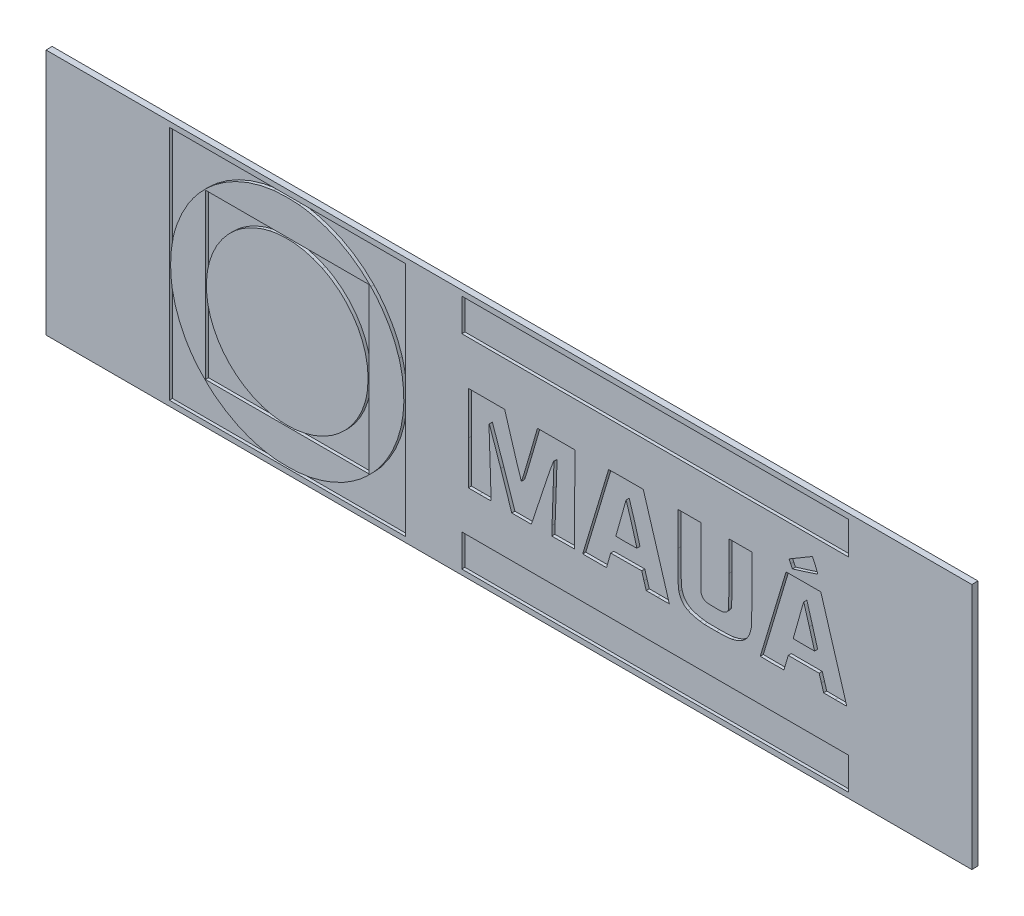
from build123d import *

# Parameters (mm, degrees)
SKETCH2_W                = 150
SKETCH2_H                = 40
BOSS_EXTRUDE1_DEPTH      = 1
CUT_EXTRUDE1_START       = -0.5
CUT_EXTRUDE1_OUTLINE_W   = 62.635342
CUT_EXTRUDE1_OUTLINE_H   = 5.214436
CUT_EXTRUDE1_OUTLINE_H_2 = 5.276518
CUT_EXTRUDE1_OUTLINE_W_2 = 38.23922
CUT_EXTRUDE1_OUTLINE_H_3 = 38.301299
CUT_EXTRUDE1_OUTLINE_W_3 = 26.506723
CUT_EXTRUDE1_OUTLINE_H_4 = 26.568808
CUT_EXTRUDE1_DEPTH       = 0.5


# Read off the part's stored shape, not the designer's step: Cut-Extrude1
with BuildPart() as part:
    # Sketch2 → Boss-Extrude1 (new body)
    with BuildSketch(Plane.XY):
        Rectangle(SKETCH2_W, SKETCH2_H)
    extrude(amount=-BOSS_EXTRUDE1_DEPTH)

    # Cut-Extrude1 outline → Cut-Extrude1 (cut)
    # profile 1 of 9: a face of its own
    with BuildSketch(Plane.XY.offset(CUT_EXTRUDE1_START)):
        with BuildLine():
            add(Edge.make_bspline(
                [(45.942737, 7.666566), (45.918534, 7.666566), (45.78378, 7.918242), (45.643276, 8.225843)],
                knots=[0, 0, 0, 0, 1, 1, 1, 1], degree=3))
            add(Edge.make_bspline(
                [(50.047431, 8.963367), (50.002706, 8.923569), (46.024116, 7.666566), (45.942737, 7.666566)],
                knots=[0, 0, 0, 0, 1, 1, 1, 1], degree=3))
            add(Edge.make_bspline(
                [(49.192561, 11.005459), (49.320102, 10.803805), (50.078834, 8.991342), (50.047431, 8.963367)],
                knots=[0, 0, 0, 0, 1, 1, 1, 1], degree=3))
            add(Edge.make_bspline(
                [(46.422932, 9.396201), (48.900621, 10.858874), (49.181903, 11.02231), (49.192561, 11.005459)],
                knots=[0, 0, 0, 0, 1, 1, 1, 1], degree=3))
            Line((46.422932, 9.396201), (45.38782, 8.785125))
            Line((45.38782, 8.785125), (45.643276, 8.225843))
        make_face()
    # profile 2 of 9: a face of its own
    with BuildSketch(Plane.XY.offset(CUT_EXTRUDE1_START)):
        with BuildLine():
            add(Edge.make_bspline(
                [(44.552099, -7.209818), (44.519281132, -7.242655852), (40.728780855, -7.236463886), (40.722749206, -7.203365117)],
                knots=[0, 0, 0, 0, 0.99920437, 0.99920437, 0.99920437, 0.99920437], degree=3))
            add(Edge.make_bspline(
                [(44.79384, -6.418346), (44.67298, -6.841562), (44.564195, -7.197726), (44.552099, -7.209818)],
                knots=[0, 0, 0, 0, 1, 1, 1, 1], degree=3))
            add(Edge.make_bspline(
                [(45.136599, -5.229851), (45.068925, -5.460301), (44.914709, -5.995132), (44.79384, -6.418346)],
                knots=[0, 0, 0, 0, 1, 1, 1, 1], degree=3))
            Line((45.136599, -5.229851), (45.259599, -4.810834))
            Line((45.259599, -4.810834), (50.261772, -4.810834))
            Line((50.261772, -4.810834), (50.629516, -6.005801))
            Line((50.629516, -6.005801), (50.997271, -7.200777))
            Line((50.997271, -7.200777), (52.853038, -7.217284))
            add(Edge.make_bspline(
                [(54.736233, -7.206296), (54.721094, -7.221436), (53.873707, -7.226297), (52.853038, -7.217284)],
                knots=[0, 0, 0, 0, 1, 1, 1, 1], degree=3))
            add(Edge.make_bspline(
                [(50.742792, 6.037049), (51.816652, 2.568567), (54.757712, -7.18481), (54.736233, -7.206296)],
                knots=[0, 0, 0, 0, 1, 1, 1, 1], degree=3))
            Line((50.742792, 6.037049), (50.526585, 6.735412))
            Line((50.526585, 6.735412), (47.724921, 6.735412))
            add(Edge.make_bspline(
                [(44.898911, 6.711057), (44.912304, 6.724501), (46.184013, 6.735412), (47.724921, 6.735412)],
                knots=[0, 0, 0, 0, 1, 1, 1, 1], degree=3))
            add(Edge.make_bspline(
                [(40.722749206, -7.203365117), (40.729056334, -7.12683128), (44.875060155, 6.687212151), (44.898911, 6.711057)],
                knots=[0.000760629, 0.000760629, 0.000760629, 0.000760629, 1, 1, 1, 1], degree=3))
        make_face()
        with BuildLine():
            add(Edge.make_bspline(
                [(46.077705, -2.001873), (46.054388, -2.062809), (46.421122, -2.079477), (47.78558, -2.079477)],
                knots=[0, 0, 0, 0, 1, 1, 1, 1], degree=3))
            add(Edge.make_bspline(
                [(46.833806, 0.682934), (46.434264, -0.751035), (46.094016, -1.959201), (46.077705, -2.001873)],
                knots=[0, 0, 0, 0, 1, 1, 1, 1], degree=3))
            add(Edge.make_bspline(
                [(47.777509, 3.92255), (47.744293, 3.955768), (47.77675, 4.066902), (46.833806, 0.682934)],
                knots=[0, 0, 0, 0, 1, 1, 1, 1], degree=3))
            add(Edge.make_bspline(
                [(48.664614, 0.907227), (48.192444, 2.549919), (47.793249, 3.906813), (47.777509, 3.92255)],
                knots=[0, 0, 0, 0, 1, 1, 1, 1], degree=3))
            Line((48.664614, 0.907227), (49.523106, -2.079477))
            Line((49.523106, -2.079477), (47.78558, -2.079477))
        make_face(mode=Mode.SUBTRACT)
    # profile 3 of 9: a face of its own
    with BuildSketch(Plane.XY.offset(CUT_EXTRUDE1_START)):
        with BuildLine():
            add(Edge.make_bspline(
                [(33.645898, -7.26488), (32.638698, -7.275158), (31.744796, -7.272222), (31.659442, -7.257487)],
                knots=[0, 0, 0, 0, 1, 1, 1, 1], degree=3))
            add(Edge.make_bspline(
                [(36.096895, -7.110611), (35.552945, -7.229598), (35.253222, -7.248454), (33.645898, -7.26488)],
                knots=[0, 0, 0, 0, 1, 1, 1, 1], degree=3))
            add(Edge.make_bspline(
                [(39.263694, -3.96361), (38.948037, -5.773778), (38.02779, -6.688265), (36.096895, -7.110611)],
                knots=[0, 0, 0, 0, 1, 1, 1, 1], degree=3))
            add(Edge.make_bspline(
                [(39.356942, 1.653258), (39.356942, -2.588698), (39.341549, -3.517299), (39.263694, -3.96361)],
                knots=[0, 0, 0, 0, 1, 1, 1, 1], degree=3))
            Line((39.356942, 1.653258), (39.356942, 6.735412))
            Line((39.356942, 6.735412), (35.632349, 6.735412))
            Line((35.632349, 6.735412), (35.632151, 1.877918))
            add(Edge.make_bspline(
                [(35.566671, -3.214073), (35.609558, -3.05969), (35.631929, -1.32014), (35.632151, 1.877918)],
                knots=[0, 0, 0, 0, 1, 1, 1, 1], degree=3))
            add(Edge.make_bspline(
                [(34.780797, -3.97945), (35.175732, -3.864643), (35.463961, -3.583918), (35.566671, -3.214073)],
                knots=[0, 0, 0, 0, 1, 1, 1, 1], degree=3))
            add(Edge.make_bspline(
                [(33.250994, -4.056044), (34.207408, -4.074424), (34.505536, -4.060095), (34.780797, -3.97945)],
                knots=[0, 0, 0, 0, 1, 1, 1, 1], degree=3))
            add(Edge.make_bspline(
                [(31.768644, -3.889079), (32.039095, -4.021522), (32.159786, -4.035117), (33.250994, -4.056044)],
                knots=[0, 0, 0, 0, 1, 1, 1, 1], degree=3))
            add(Edge.make_bspline(
                [(31.17246, -3.203105), (31.287875, -3.543396), (31.454678, -3.735319), (31.768644, -3.889079)],
                knots=[0, 0, 0, 0, 1, 1, 1, 1], degree=3))
            add(Edge.make_bspline(
                [(31.100899, 1.871662), (31.100899, -1.6376), (31.120849, -3.050854), (31.17246, -3.203105)],
                knots=[0, 0, 0, 0, 1, 1, 1, 1], degree=3))
            Line((31.100899, 1.871662), (31.100899, 6.735412))
            Line((31.100899, 6.735412), (27.37065, 6.735412))
            Line((27.37065, 6.735412), (27.390803, 1.257148))
            add(Edge.make_bspline(
                [(27.547297, -4.706177), (27.412408, -4.226134), (27.410783, -4.164378), (27.390803, 1.257148)],
                knots=[0, 0, 0, 0, 1, 1, 1, 1], degree=3))
            add(Edge.make_bspline(
                [(28.982152, -6.606978), (28.240379, -6.232535), (27.819535, -5.675027), (27.547297, -4.706177)],
                knots=[0, 0, 0, 0, 1, 1, 1, 1], degree=3))
            add(Edge.make_bspline(
                [(30.94567, -7.162868), (30.255869, -7.077296), (29.477078, -6.856821), (28.982152, -6.606978)],
                knots=[0, 0, 0, 0, 1, 1, 1, 1], degree=3))
            add(Edge.make_bspline(
                [(31.659553, -7.25788), (31.574195, -7.243702), (31.252948, -7.200985), (30.94567, -7.162868)],
                knots=[0, 0, 0, 0, 1, 1, 1, 1], degree=3))
            Line((31.659553, -7.25788), (31.659442, -7.257487))
        make_face()
    # profile 4 of 9: a face of its own
    with BuildSketch(Plane.XY.offset(CUT_EXTRUDE1_START)):
        with BuildLine():
            add(Edge.make_bspline(
                [(25.988622, -7.212433), (25.977938, -7.223168), (25.130493, -7.231826), (24.105414, -7.231826)],
                knots=[0, 0, 0, 0, 1, 1, 1, 1], degree=3))
            add(Edge.make_bspline(
                [(23.888579, -0.228801), (25.054299, -4.059103), (25.999316, -7.201739), (25.988622, -7.212433)],
                knots=[0, 0, 0, 0, 1, 1, 1, 1], degree=3))
            Line((23.888579, -0.228801), (21.769087, 6.735387))
            Line((21.769087, 6.735387), (18.97543, 6.735387))
            add(Edge.make_bspline(
                [(16.153235, 6.706883), (16.168932, 6.722529), (17.438917, 6.735387), (18.97543, 6.735387)],
                knots=[0, 0, 0, 0, 1, 1, 1, 1], degree=3))
            add(Edge.make_bspline(
                [(12.002401, -7.061116), (12.05864, -6.799296), (16.120749, 6.674396), (16.153235, 6.706883)],
                knots=[0, 0, 0, 0, 1, 1, 1, 1], degree=3))
            Line((12.002401, -7.061116), (11.965732, -7.231788))
            Line((11.965732, -7.231788), (15.812636, -7.231788))
            Line((15.812636, -7.231788), (16.153494, -6.036806))
            Line((16.153494, -6.036806), (16.494361, -4.84183))
            Line((16.494361, -4.84183), (21.510019, -4.81064))
            Line((21.510019, -4.81064), (21.875824, -6.021229))
            Line((21.875824, -6.021229), (22.241624, -7.231826))
            Line((22.241624, -7.231826), (24.105414, -7.231826))
        make_face()
        with BuildLine():
            add(Edge.make_bspline(
                [(19.02695, -2.079399), (19.96586, -2.079399), (20.734058, -2.058487), (20.734058, -2.032919)],
                knots=[0, 0, 0, 0, 1, 1, 1, 1], degree=3))
            add(Edge.make_bspline(
                [(17.319847, -2.049021), (17.319847, -2.06573), (18.088045, -2.079399), (19.02695, -2.079399)],
                knots=[0, 0, 0, 0, 1, 1, 1, 1], degree=3))
            add(Edge.make_bspline(
                [(18.989537, 3.86311), (18.950903, 3.791043), (17.319847, -1.984209), (17.319847, -2.049021)],
                knots=[0, 0, 0, 0, 1, 1, 1, 1], degree=3))
            add(Edge.make_bspline(
                [(20.734058, -2.032919), (20.734058, -1.861878), (19.022155, 3.923937), (18.989537, 3.86311)],
                knots=[0, 0, 0, 0, 1, 1, 1, 1], degree=3))
        make_face(mode=Mode.SUBTRACT)
    # profile 5 of 9: a face of its own
    with BuildSketch(Plane.XY.offset(CUT_EXTRUDE1_START)):
        with BuildLine():
            add(Edge.make_bspline(
                [(-2.879869, -7.214481), (-2.888932, -7.223545), (-3.725147, -7.231039), (-4.738031, -7.231039)],
                knots=[0, 0, 0, 0, 1, 1, 1, 1], degree=3))
            add(Edge.make_bspline(
                [(-3.002646, -3.288132), (-2.926017, -5.438516), (-2.870752, -7.205362), (-2.879869, -7.214481)],
                knots=[0, 0, 0, 0, 1, 1, 1, 1], degree=3))
            add(Edge.make_bspline(
                [(-3.176847, 3.446132), (-3.239534, 3.446132), (-3.231101, 3.121002), (-3.002646, -3.288132)],
                knots=[0, 0, 0, 0, 1, 1, 1, 1], degree=3))
            add(Edge.make_bspline(
                [(-1.326126, -1.891785), (-2.311847, 1.044068), (-3.144657, 3.446132), (-3.176847, 3.446132)],
                knots=[0, 0, 0, 0, 1, 1, 1, 1], degree=3))
            Line((-1.326126, -1.891785), (0.466063, -7.229712))
            Line((0.466063, -7.229712), (3.638599, -7.231737))
            Line((3.638599, -7.231737), (5.401876, -1.893139))
            add(Edge.make_bspline(
                [(7.297261, 3.429932), (7.213842, 3.528615), (6.920808, 2.705656), (5.401876, -1.893139)],
                knots=[0, 0, 0, 0, 1, 1, 1, 1], degree=3))
            add(Edge.make_bspline(
                [(7.174763, -0.37226), (7.249346, 1.710408), (7.304477, 3.421393), (7.297261, 3.429932)],
                knots=[0, 0, 0, 0, 1, 1, 1, 1], degree=3))
            add(Edge.make_bspline(
                [(6.990921, -5.696275), (7.017453, -4.850739), (7.100164, -2.454938), (7.174763, -0.37226)],
                knots=[0, 0, 0, 0, 1, 1, 1, 1], degree=3))
            Line((6.990921, -5.696275), (6.942768, -7.233603))
            Line((6.942768, -7.233603), (10.646677, -7.200792))
            Line((10.646677, -7.200792), (10.678171014, 6.735412))
            Line((10.678171014, 6.735412), (4.622462, 6.735412))
            Line((4.622462, 6.735412), (3.356548, 2.359009))
            add(Edge.make_bspline(
                [(2.020318, -2.017395), (2.060065, -2.017395), (2.641156, -0.114222), (3.356548, 2.359009)],
                knots=[0, 0, 0, 0, 1, 1, 1, 1], degree=3))
            add(Edge.make_bspline(
                [(-0.562905, 6.316401), (0.99055, 1.123543), (1.964139, -2.017395), (2.020318, -2.017395)],
                knots=[0, 0, 0, 0, 1, 1, 1, 1], degree=3))
            Line((-0.562905, 6.316401), (-0.688254, 6.735412))
            Line((-0.688254, 6.735412), (-6.579674, 6.735412))
            Line((-6.579674, 6.735412), (-6.579674, -0.248212))
            Line((-6.579674, -0.248212), (-6.579643, -7.231039))
            Line((-6.579643, -7.231039), (-4.738031, -7.231039))
        make_face()
    # profile 6 of 9: a face of its own
    with BuildSketch(Plane.XY.offset(CUT_EXTRUDE1_START)):
        with Locations((23.6827, -16.543336)):
            Rectangle(CUT_EXTRUDE1_OUTLINE_W, CUT_EXTRUDE1_OUTLINE_H)
    # profile 7 of 9: a face of its own
    with BuildSketch(Plane.XY.offset(CUT_EXTRUDE1_START)):
        with Locations((23.6827, 16.512486)):
            Rectangle(CUT_EXTRUDE1_OUTLINE_W, CUT_EXTRUDE1_OUTLINE_H_2)
    # profile 8 of 9: a face of its own
    with BuildSketch(Plane.XY.offset(CUT_EXTRUDE1_START)):
        with Locations((-35.879852, 9.55e-05)):
            Rectangle(CUT_EXTRUDE1_OUTLINE_W_2, CUT_EXTRUDE1_OUTLINE_H_3)
        with BuildLine():
            add(Edge.make_bspline(
                [(-37.462796, -18.86188), (-37.024475, -18.912979), (-34.722421, -18.896921), (-34.132755, -18.838588)],
                knots=[0, 0, 0, 0, 1, 1, 1, 1], degree=3))
            add(Edge.make_bspline(
                [(-38.238769, -18.77303), (-37.914405, -18.80999), (-37.565226, -18.849933), (-37.462796, -18.86188)],
                knots=[0, 0, 0, 0, 1, 1, 1, 1], degree=3))
            add(Edge.make_bspline(
                [(-47.73649, -14.755011), (-44.926169, -16.984831), (-41.605228, -18.389761), (-38.238769, -18.77303)],
                knots=[0, 0, 0, 0, 1, 1, 1, 1], degree=3))
            add(Edge.make_bspline(
                [(-50.701427, -11.781864), (-50.074039, -12.574108), (-48.515686, -14.136765), (-47.73649, -14.755011)],
                knots=[0, 0, 0, 0, 1, 1, 1, 1], degree=3))
            add(Edge.make_bspline(
                [(-54.556113, -3.196796), (-54.022115, -6.314772), (-52.701217, -9.256637), (-50.701427, -11.781864)],
                knots=[0, 0, 0, 0, 1, 1, 1, 1], degree=3))
            add(Edge.make_bspline(
                [(-54.379907, 4.066175), (-54.883513, 1.810952), (-54.949306, -0.90099), (-54.556113, -3.196796)],
                knots=[0, 0, 0, 0, 1, 1, 1, 1], degree=3))
            add(Edge.make_bspline(
                [(-51.96446, 9.932422), (-53.072822, 8.167999), (-53.927422, 6.092503), (-54.379907, 4.066175)],
                knots=[0, 0, 0, 0, 1, 1, 1, 1], degree=3))
            add(Edge.make_bspline(
                [(-38.083571, 18.749527), (-43.807701, 18.069812), (-48.874483, 14.851407), (-51.96446, 9.932422)],
                knots=[0, 0, 0, 0, 1, 1, 1, 1], degree=3))
            add(Edge.make_bspline(
                [(-34.017548, 18.783604), (-34.974395, 18.889165), (-37.054192, 18.871702), (-38.083571, 18.749527)],
                knots=[0, 0, 0, 0, 1, 1, 1, 1], degree=3))
            add(Edge.make_bspline(
                [(-22.367056, 13.111351), (-25.471849, 16.319644), (-29.511663, 18.28651), (-34.017548, 18.783604)],
                knots=[0, 0, 0, 0, 1, 1, 1, 1], degree=3))
            add(Edge.make_bspline(
                [(-17.793863, 5.331358), (-18.605252, 8.123871), (-20.252643, 10.926448), (-22.367056, 13.111351)],
                knots=[0, 0, 0, 0, 1, 1, 1, 1], degree=3))
            add(Edge.make_bspline(
                [(-21.196799, -11.857711), (-17.298582, -6.975218), (-16.050248, -0.669557), (-17.793863, 5.331358)],
                knots=[0, 0, 0, 0, 1, 1, 1, 1], degree=3))
            add(Edge.make_bspline(
                [(-24.107775, -14.757768), (-23.269062, -14.09003), (-21.851779, -12.678059), (-21.196799, -11.857711)],
                knots=[0, 0, 0, 0, 1, 1, 1, 1], degree=3))
            add(Edge.make_bspline(
                [(-34.132755, -18.838588), (-30.436143, -18.473472), (-27.036736, -17.089643), (-24.107775, -14.757768)],
                knots=[0, 0, 0, 0, 1, 1, 1, 1], degree=3))
        make_face(mode=Mode.SUBTRACT)
    # profile 9 of 9: a face of its own
    with BuildSketch(Plane.XY.offset(CUT_EXTRUDE1_START)):
        with Locations((-35.9108845, -0.030944)):
            Rectangle(CUT_EXTRUDE1_OUTLINE_W_3, CUT_EXTRUDE1_OUTLINE_H_4)
        with BuildLine():
            add(Edge.make_bspline(
                [(-45.349492, -9.087016), (-42.564289564, -11.984634228), (-38.582402577, -13.462014571), (-34.62936331, -13.064510477)],
                knots=[0, 0, 0, 0, 0.999935892, 0.999935892, 0.999935892, 0.999935892], degree=3))
            add(Edge.make_bspline(
                [(-44.253176, 10.06104), (-50.140896, 5.141704), (-50.640398, -3.582551), (-45.349492, -9.087016)],
                knots=[0, 0, 0, 0, 1, 1, 1, 1], degree=3))
            add(Edge.make_bspline(
                [(-38.76563, 12.755637), (-40.652347, 12.344641), (-42.756874, 11.311233), (-44.253176, 10.06104)],
                knots=[0, 0, 0, 0, 1, 1, 1, 1], degree=3))
            add(Edge.make_bspline(
                [(-30.199054, 11.736773), (-32.869499, 13.041451), (-35.834666, 13.394111), (-38.76563, 12.755637)],
                knots=[0, 0, 0, 0, 1, 1, 1, 1], degree=3))
            add(Edge.make_bspline(
                [(-22.936166, 1.757088), (-23.553622, 6.100853), (-26.251733, 9.80824), (-30.199054, 11.736773)],
                knots=[0, 0, 0, 0, 1, 1, 1, 1], degree=3))
            add(Edge.make_bspline(
                [(-22.940217, -1.835665), (-22.816538, -0.948978), (-22.814862, 0.89824), (-22.936166, 1.757088)],
                knots=[0, 0, 0, 0, 1, 1, 1, 1], degree=3))
            add(Edge.make_bspline(
                [(-34.628610704, -13.064357477), (-28.648472381, -12.462287662), (-23.768517898, -7.774312328), (-22.940217, -1.835665)],
                knots=[4.2377e-05, 4.2377e-05, 4.2377e-05, 4.2377e-05, 1, 1, 1, 1], degree=3))
            add(Edge.make_bspline(
                [(-34.62936331, -13.064510477), (-34.629109873, -13.064484993), (-34.628856436, -13.0644595), (-34.628610704, -13.064357477)],
                knots=[0.999935892, 0.999935892, 0.999935892, 0.999935892, 1, 1, 1, 1], degree=3))
        make_face(mode=Mode.SUBTRACT)
    extrude(amount=CUT_EXTRUDE1_DEPTH, mode=Mode.SUBTRACT)


solid = part.part
